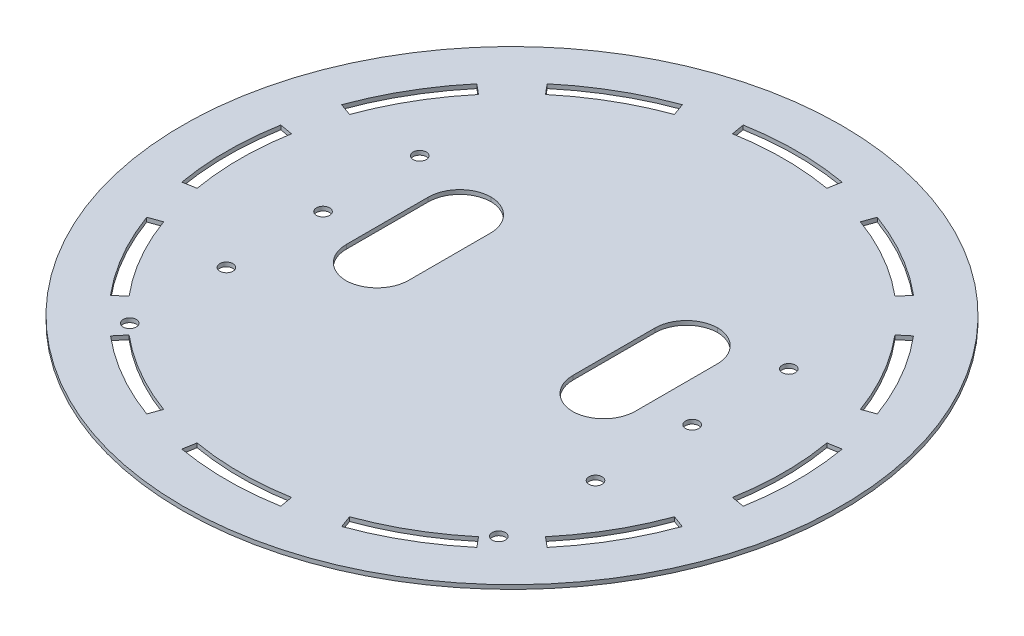
from build123d import *

# Parameters (mm, degrees)
SKETCH1_R            = 1.5875
BOSS_EXTRUDE5_DEPTH  = 1.5875
FILLET2_R            = 2.54
FILLET3_R            = 2.54
FILLET4_R            = 5.08
CUT_EXTRUDE1_START   = -2.54
SKETCH2_R            = 2.38125
SKETCH2_R_2          = 1.5875
CUT_EXTRUDE1_DEPTH   = 2.54
SKETCH3_R            = 1.5875
CUT_EXTRUDE2_DEPTH   = 2.54
CUT_EXTRUDE3_DEPTH   = 2.54
SKETCH5_W            = 15
SKETCH5_H            = 34.925
CUT_EXTRUDE4_DEPTH   = 109.650407999
FILLET5_R            = 7.62
FILLET6_R            = 7.62
BOSS_EXTRUDE6_START  = -1.5875
BOSS_EXTRUDE6_DEPTH  = 1.5875
SKETCH7_R            = 79.375
CUT_EXTRUDE5_DEPTH   = 0.5875
BOSS_EXTRUDE7_START  = -1
SKETCH8_R            = 1.5875
SKETCH8_R_2          = 2.38125
BOSS_EXTRUDE7_DEPTH  = 1
SKETCH9_R            = 1.5875
CUT_EXTRUDE7_DEPTH   = 2.54
BOSS_EXTRUDE8_START  = -1
BOSS_EXTRUDE8_DEPTH  = 1
CUT_EXTRUDE9_START   = -2.54
CUT_EXTRUDE9_DEPTH   = 2.54
BOSS_EXTRUDE9_START  = -1
BOSS_EXTRUDE9_DEPTH  = 1
CUT_EXTRUDE10_START  = -2.54
CUT_EXTRUDE10_DEPTH  = 2.54
BOSS_EXTRUDE10_START = -1
BOSS_EXTRUDE10_DEPTH = 1
CUT_EXTRUDE11_START  = -2.54
CUT_EXTRUDE11_DEPTH  = 2.54
BOSS_EXTRUDE11_START = -1
BOSS_EXTRUDE11_DEPTH = 1


with BuildPart() as part:
    # Sketch1 → Boss-Extrude5 (new body)
    with BuildSketch(Plane(origin=(0, 0, 0), x_dir=(1, 0, 0), z_dir=(0, 1, 0))):
        with BuildLine():
            ThreePointArc((-63.5, -47.625), (-35.497579143, -70.995158286), (0, -79.375))
            ThreePointArc((0, -79.375), (35.497579143, -70.995158286), (63.5, -47.625))
            Line((63.5, -47.625), (50.8, -47.625))
            Line((50.8, -47.625), (50.8, 22.225))
            Line((50.8, 22.225), (76.2, 22.225))
            ThreePointArc((76.2, 22.225), (0, 79.375), (-76.2, 22.225))
            Line((-76.2, 22.225), (-50.8, 22.225))
            Line((-50.8, 22.225), (-50.8, -47.625))
            Line((-50.8, -47.625), (-63.5, -47.625))
        make_face()
        with Locations(Location((-7.14375, -66.675, 0), (0, 0, 270))):
            Circle(SKETCH1_R, mode=Mode.SUBTRACT)
        with BuildLine():
            ThreePointArc((8.73125, -66.675), (7.14375, -68.2625), (5.55625, -66.675))
            ThreePointArc((5.55625, -66.675), (7.14375, -65.0875), (8.73125, -66.675))
        make_face(mode=Mode.SUBTRACT)
        with Locations(Location((-7.14375, 66.675, 0), (0, 0, 270))):
            Circle(SKETCH1_R, mode=Mode.SUBTRACT)
        with Locations(Location((7.14375, 66.675, 0), (0, 0, 270))):
            Circle(SKETCH1_R, mode=Mode.SUBTRACT)
    extrude(amount=BOSS_EXTRUDE5_DEPTH)

    # Fillet2
    fillet2_edges = [part.edges().sort_by_distance(p)[0] for p in [
        (-63.5, 0.79375, 47.625),
    ]]
    fillet(fillet2_edges, radius=FILLET2_R)

    # Fillet3
    fillet3_edges = [part.edges().sort_by_distance(p)[0] for p in [
        (63.5, 0.79375, 47.625),
    ]]
    fillet(fillet3_edges, radius=FILLET3_R)

    # Fillet4
    fillet4_edges = [part.edges().sort_by_distance(p)[0] for p in [
        (-76.2, 0.79375, -22.225),
        (76.2, 0.79375, -22.225),
    ]]
    fillet(fillet4_edges, radius=FILLET4_R)

    # Sketch2 → Cut-Extrude1 (cut)
    # profile 1 of 10: a face of its own
    with BuildSketch(Plane(origin=(0, 1.5875, 0), x_dir=(1, 0, 0), z_dir=(0, 1, 0)).offset(CUT_EXTRUDE1_START)):
        with BuildLine():
            Line((-61.088622125, 27.654457796), (-59.642408406, 26.999765402))
            ThreePointArc((-59.642408406, 26.999765402), (-52.384826382, 39.268743005), (-42.643785254, 49.676068599))
            Line((-42.643785254, 49.676068599), (-43.677815048, 50.880617741))
            Line((-43.677815048, 50.880617741), (-44.711844841, 52.085166883))
            ThreePointArc((-44.711844841, 52.085166883), (-54.925289002, 41.173126022), (-62.534835843, 28.309150189))
            Line((-62.534835843, 28.309150189), (-61.088622125, 27.654457796))
        make_face()
    # profile 2 of 10: a face of its own
    with BuildSketch(Plane(origin=(0, 1.5875, 0), x_dir=(1, 0, 0), z_dir=(0, 1, 0)).offset(CUT_EXTRUDE1_START)):
        with BuildLine():
            Line((-39.077069744, 54.493774041), (-38.151958122, 53.203686937))
            ThreePointArc((-38.151958122, 53.203686937), (-25.732218917, 60.200142208), (-12.092567045, 64.342629994))
            Line((-12.092567045, 64.342629994), (-12.385788543, 65.902815048))
            Line((-12.385788543, 65.902815048), (-12.679010041, 67.463000102))
            ThreePointArc((-12.679010041, 67.463000102), (-26.980132574, 63.119617589), (-40.002181367, 55.783861145))
            Line((-40.002181367, 55.783861145), (-39.077069744, 54.493774041))
        make_face()
    # profile 3 of 10: a face of its own
    with BuildSketch(Plane(origin=(0, 1.5875, 0), x_dir=(1, 0, 0), z_dir=(0, 1, 0)).offset(CUT_EXTRUDE1_START)):
        with Locations(Location((-7.14375, 66.675, 0), (0, 0, 270))):
            Circle(SKETCH2_R)
        with Locations((-7.14375, 66.675)):
            Circle(SKETCH2_R_2, mode=Mode.SUBTRACT)
    # profile 4 of 10: a face of its own
    with BuildSketch(Plane(origin=(0, 1.5875, 0), x_dir=(1, 0, 0), z_dir=(0, 1, 0)).offset(CUT_EXTRUDE1_START)):
        with Locations(Location((7.14375, 66.675, 0), (0, 0, 270))):
            Circle(SKETCH2_R)
        with Locations((7.14375, 66.675)):
            Circle(SKETCH2_R_2, mode=Mode.SUBTRACT)
    # profile 5 of 10: a face of its own
    with BuildSketch(Plane(origin=(0, 1.5875, 0), x_dir=(1, 0, 0), z_dir=(0, 1, 0)).offset(CUT_EXTRUDE1_START)):
        with BuildLine():
            ThreePointArc((12.679010041, 67.463000102), (26.980132574, 63.119617589), (40.002181367, 55.783861145))
            Line((40.002181367, 55.783861145), (39.077069744, 54.493774041))
            Line((39.077069744, 54.493774041), (38.151958122, 53.203686937))
            ThreePointArc((38.151958122, 53.203686937), (25.732218917, 60.200142208), (12.092567045, 64.342629994))
            Line((12.092567045, 64.342629994), (12.385788543, 65.902815048))
            Line((12.385788543, 65.902815048), (12.679010041, 67.463000102))
        make_face()
    # profile 6 of 10: a face of its own
    with BuildSketch(Plane(origin=(0, 1.5875, 0), x_dir=(1, 0, 0), z_dir=(0, 1, 0)).offset(CUT_EXTRUDE1_START)):
        with BuildLine():
            ThreePointArc((44.711844841, 52.085166883), (54.925289002, 41.173126022), (62.534835843, 28.309150189))
            Line((62.534835843, 28.309150189), (59.642408406, 26.999765402))
            ThreePointArc((59.642408406, 26.999765402), (52.384826382, 39.268743005), (42.643785254, 49.676068599))
            Line((42.643785254, 49.676068599), (43.677815048, 50.880617741))
            Line((43.677815048, 50.880617741), (44.711844841, 52.085166883))
        make_face()
    # profile 7 of 10: a face of its own
    with BuildSketch(Plane(origin=(0, 1.5875, 0), x_dir=(1, 0, 0), z_dir=(0, 1, 0)).offset(CUT_EXTRUDE1_START)):
        with BuildLine():
            ThreePointArc((-12.679010041, -67.463000102), (-26.980132574, -63.119617589), (-40.002181367, -55.783861145))
            Line((-40.002181367, -55.783861145), (-39.077069744, -54.493774041))
            Line((-39.077069744, -54.493774041), (-38.151958122, -53.203686937))
            ThreePointArc((-38.151958122, -53.203686937), (-25.732218917, -60.200142208), (-12.092567045, -64.342629994))
            Line((-12.092567045, -64.342629994), (-12.385788543, -65.902815048))
            Line((-12.385788543, -65.902815048), (-12.679010041, -67.463000102))
        make_face()
    # profile 8 of 10: a face of its own
    with BuildSketch(Plane(origin=(0, 1.5875, 0), x_dir=(1, 0, 0), z_dir=(0, 1, 0)).offset(CUT_EXTRUDE1_START)):
        with Locations(Location((-7.14375, -66.675, 0), (0, 0, 270))):
            Circle(SKETCH2_R)
        with Locations((-7.14375, -66.675)):
            Circle(SKETCH2_R_2, mode=Mode.SUBTRACT)
    # profile 9 of 10: a face of its own
    with BuildSketch(Plane(origin=(0, 1.5875, 0), x_dir=(1, 0, 0), z_dir=(0, 1, 0)).offset(CUT_EXTRUDE1_START)):
        with Locations(Location((7.14375, -66.675, 0), (0, 0, 270))):
            Circle(SKETCH2_R)
        with Locations((7.14375, -66.675)):
            Circle(SKETCH2_R_2, mode=Mode.SUBTRACT)
    # profile 10 of 10: a face of its own
    with BuildSketch(Plane(origin=(0, 1.5875, 0), x_dir=(1, 0, 0), z_dir=(0, 1, 0)).offset(CUT_EXTRUDE1_START)):
        with BuildLine():
            ThreePointArc((12.092567045, -64.342629994), (25.732218917, -60.200142208), (38.151958122, -53.203686937))
            Line((38.151958122, -53.203686937), (39.077069744, -54.493774041))
            Line((39.077069744, -54.493774041), (40.002181367, -55.783861145))
            ThreePointArc((40.002181367, -55.783861145), (26.980132574, -63.119617589), (12.679010041, -67.463000102))
            Line((12.679010041, -67.463000102), (12.385788543, -65.902815048))
            Line((12.385788543, -65.902815048), (12.092567045, -64.342629994))
        make_face()
    extrude(amount=CUT_EXTRUDE1_DEPTH, mode=Mode.SUBTRACT)

    # Sketch3 → Cut-Extrude2 (cut)
    with BuildSketch(Plane(origin=(0, 1.5875, 0), x_dir=(1, 0, 0), z_dir=(0, 1, 0))):
        with Locations(Location((-44.45, -47.625, 0), (0, 0, 270))):
            Circle(SKETCH3_R)
        with Locations(Location((-44.45, 22.225, 0), (0, 0, 270))):
            Circle(SKETCH3_R)
        with Locations(Location((44.45, 22.225, 0), (0, 0, 270))):
            Circle(SKETCH3_R)
        with Locations(Location((44.45, -47.625, 0), (0, 0, 270))):
            Circle(SKETCH3_R)
    extrude(amount=-CUT_EXTRUDE2_DEPTH, mode=Mode.SUBTRACT)

    # Sketch4 → Cut-Extrude3 (cut)
    with BuildSketch(Plane(origin=(0, 1.5875, 0), x_dir=(1, 0, 0), z_dir=(0, 1, 0))):
        with BuildLine():
            ThreePointArc((-44.45, -11.1125), (-46.0375, -12.7), (-44.45, -14.2875))
            Line((-44.45, -14.2875), (-44.45, -11.1125))
        make_face()
        with BuildLine():
            Line((-44.45, -11.1125), (-44.45, -14.2875))
            ThreePointArc((-44.45, -14.2875), (-43.327467985, -13.822532015), (-42.8625, -12.7))
            ThreePointArc((-42.8625, -12.7), (-43.327467985, -11.577467985), (-44.45, -11.1125))
        make_face()
        with BuildLine():
            ThreePointArc((44.45, -11.1125), (42.8625, -12.7), (44.45, -14.2875))
            Line((44.45, -14.2875), (44.45, -11.1125))
        make_face()
        with BuildLine():
            Line((44.45, -11.1125), (44.45, -14.2875))
            ThreePointArc((44.45, -14.2875), (45.572532015, -13.822532015), (46.0375, -12.7))
            ThreePointArc((46.0375, -12.7), (45.572532015, -11.577467985), (44.45, -11.1125))
        make_face()
    extrude(amount=-CUT_EXTRUDE3_DEPTH, mode=Mode.SUBTRACT)

    # Sketch5 → Cut-Extrude4 (cut, through all)
    with BuildSketch(Plane(origin=(0, 1.5875, 0), x_dir=(1, 0, 0), z_dir=(0, 1, 0))):
        with Locations((-27.3, 4.7625)):
            Rectangle(SKETCH5_W, SKETCH5_H)
        with Locations((27.3, 4.7625)):
            Rectangle(SKETCH5_W, SKETCH5_H)
    extrude(amount=-CUT_EXTRUDE4_DEPTH, mode=Mode.SUBTRACT)

    # Fillet5
    # the kernel refuses this fillet: 7.62 mm, written as the material it adds along each edge
    with BuildSketch(Plane(origin=(-19.8, 1.5875, 12.7), x_dir=(0, 0, -1), z_dir=(0, -1, 0))) as fillet5_piece_1:
        with BuildLine():
            CenterArc((FILLET5_R, -FILLET5_R), FILLET5_R, 90, 90)
            Line((0, -FILLET5_R), (0, 0))
            Line((0, 0), (FILLET5_R, 0))
        make_face()
    extrude(amount=1.5875)
    with BuildSketch(Plane(origin=(-34.8, 1.5875, 12.7), x_dir=(0, 0, -1), z_dir=(0, -1, 0)), Plane(origin=(-19.8, 1.5875, -22.225), x_dir=(0, 0, 1), z_dir=(0, -1, 0)), Plane(origin=(-34.8, 1.5875, -22.225), x_dir=(1, 0, 0), z_dir=(0, -1, 0))) as fillet5_piece_2:
        with BuildLine():
            CenterArc((FILLET5_R, FILLET5_R), FILLET5_R, 180, 90)
            Line((0, FILLET5_R), (0, 0))
            Line((0, 0), (FILLET5_R, 0))
        make_face()
    extrude(amount=1.5875)

    # Fillet6
    # the kernel refuses this fillet: 7.62 mm, written as the material it adds along each edge
    with BuildSketch(Plane(origin=(34.8, 1.5875, 12.7), x_dir=(0, 0, -1), z_dir=(0, -1, 0)), Plane(origin=(34.8, 1.5875, -22.225), x_dir=(-1, 0, 0), z_dir=(0, -1, 0))) as fillet6_piece_1:
        with BuildLine():
            CenterArc((FILLET6_R, -FILLET6_R), FILLET6_R, 90, 90)
            Line((0, -FILLET6_R), (0, 0))
            Line((0, 0), (FILLET6_R, 0))
        make_face()
    extrude(amount=1.5875)
    with BuildSketch(Plane(origin=(19.8, 1.5875, -22.225), x_dir=(1, 0, 0), z_dir=(0, -1, 0)), Plane(origin=(19.8, 1.5875, 12.7), x_dir=(0, 0, -1), z_dir=(0, -1, 0))) as fillet6_piece_2:
        with BuildLine():
            CenterArc((FILLET6_R, FILLET6_R), FILLET6_R, 180, 90)
            Line((0, FILLET6_R), (0, 0))
            Line((0, 0), (FILLET6_R, 0))
        make_face()
    extrude(amount=1.5875)

    # Sketch6 → Boss-Extrude6 (add)
    with BuildSketch(Plane(origin=(0, 1.5875, 0), x_dir=(1, 0, 0), z_dir=(0, 1, 0)).offset(BOSS_EXTRUDE6_START)):
        with BuildLine():
            Line((-50.8, -60.989758362), (-50.8, 22.225))
            Line((-50.8, 22.225), (-69.095470184, 22.225))
            Line((-69.095470184, 22.225), (-69.095470184, 39.066694575))
            ThreePointArc((-69.095470184, 39.066694575), (-78.080435361, -14.277122916), (-50.8, -60.989758362))
        make_face()
        with BuildLine():
            Line((50.8, 22.225), (50.8, -60.989758362))
            ThreePointArc((50.8, -60.989758362), (71.877119534, -33.675960454), (79.375, 0))
            ThreePointArc((79.375, 0), (76.762111653, 20.198238526), (69.095470184, 39.066694575))
            Line((69.095470184, 39.066694575), (69.095470184, 22.225))
            Line((69.095470184, 22.225), (50.8, 22.225))
        make_face()
    extrude(amount=BOSS_EXTRUDE6_DEPTH)

    # Sketch7 → Cut-Extrude5 (cut)
    with BuildSketch(Plane.XZ):
        with Locations(Location((0, 0, 0), (0, 0, 270))):
            Circle(SKETCH7_R)
    extrude(amount=-CUT_EXTRUDE5_DEPTH, mode=Mode.SUBTRACT)

    # Sketch8 → Boss-Extrude7 (add)
    with BuildSketch(Plane(origin=(0, 1.5875, 0), x_dir=(1, 0, 0), z_dir=(0, 1, 0)).offset(BOSS_EXTRUDE7_START)):
        with Locations((-44.45, -12.7)):
            Circle(SKETCH8_R)
        with Locations((44.45, -12.7)):
            Circle(SKETCH8_R)
        with Locations((-7.14375, -66.675)):
            Circle(SKETCH8_R_2)
        with Locations((7.14375, -66.675)):
            Circle(SKETCH8_R_2)
        with Locations((-7.14375, 66.675)):
            Circle(SKETCH8_R_2)
        with Locations((7.14375, 66.675)):
            Circle(SKETCH8_R_2)
    extrude(amount=BOSS_EXTRUDE7_DEPTH)

    # Sketch9 → Cut-Extrude7 (cut)
    with BuildSketch(Plane(origin=(0, 1.5875, 0), x_dir=(1, 0, 0), z_dir=(0, 1, 0))):
        with Locations(Location((-44.45, -1.058333333, 0), (0, 0, 270))):
            Circle(SKETCH9_R)
        with Locations(Location((-44.45, -24.341666667, 0), (0, 0, 270))):
            Circle(SKETCH9_R)
        with Locations(Location((44.45, -24.341666667, 0), (0, 0, 270))):
            Circle(SKETCH9_R)
        with Locations(Location((44.45, -1.058333333, 0), (0, 0, 270))):
            Circle(SKETCH9_R)
    extrude(amount=-CUT_EXTRUDE7_DEPTH, mode=Mode.SUBTRACT)

    # Sketch10 → Boss-Extrude8 (add)
    with BuildSketch(Plane(origin=(0, 1.5875, 0), x_dir=(1, 0, 0), z_dir=(0, 1, 0)).offset(BOSS_EXTRUDE8_START)):
        with BuildLine():
            Line((-44.711844841, 52.085166883), (-42.643785254, 49.676068599))
            ThreePointArc((-42.643785254, 49.676068599), (-52.384826382, 39.268743005), (-59.642408406, 26.999765402))
            Line((-59.642408406, 26.999765402), (-62.534835843, 28.309150189))
            ThreePointArc((-62.534835843, 28.309150189), (-54.925289002, 41.173126022), (-44.711844841, 52.085166883))
        make_face()
        with BuildLine():
            Line((-12.679010041, 67.463000102), (-12.092567045, 64.342629994))
            ThreePointArc((-12.092567045, 64.342629994), (-25.732218917, 60.200142208), (-38.151958122, 53.203686937))
            Line((-38.151958122, 53.203686937), (-40.002181367, 55.783861145))
            ThreePointArc((-40.002181367, 55.783861145), (-26.980132574, 63.119617589), (-12.679010041, 67.463000102))
        make_face()
        with BuildLine():
            Line((12.092567045, 64.342629994), (12.679010041, 67.463000102))
            ThreePointArc((12.679010041, 67.463000102), (26.980132574, 63.119617589), (40.002181367, 55.783861145))
            Line((40.002181367, 55.783861145), (38.151958122, 53.203686937))
            ThreePointArc((38.151958122, 53.203686937), (25.732218917, 60.200142208), (12.092567045, 64.342629994))
        make_face()
        with BuildLine():
            Line((42.643785254, 49.676068599), (44.711844841, 52.085166883))
            ThreePointArc((44.711844841, 52.085166883), (54.925289002, 41.173126022), (62.534835843, 28.309150189))
            Line((62.534835843, 28.309150189), (59.642408406, 26.999765402))
            ThreePointArc((59.642408406, 26.999765402), (52.384826382, 39.268743005), (42.643785254, 49.676068599))
        make_face()
    extrude(amount=BOSS_EXTRUDE8_DEPTH)

    # Sketch11 → Cut-Extrude9 (cut)
    with BuildSketch(Plane(origin=(0, 1.5875, 0), x_dir=(1, 0, 0), z_dir=(0, 1, 0)).offset(CUT_EXTRUDE9_START)):
        with BuildLine():
            Line((11.919924408, -67.601250584), (11.368591443, -64.474485968))
            ThreePointArc((11.368591443, -64.474485968), (0, -65.46910884), (-11.368591443, -64.474485968))
            Line((-11.368591443, -64.474485968), (-11.919924408, -67.601250584))
            ThreePointArc((-11.919924408, -67.601250584), (0, -68.64410884), (11.919924408, -67.601250584))
        make_face()
        with BuildLine():
            Line((-11.919924408, 67.601250584), (-11.368591443, 64.474485968))
            ThreePointArc((-11.368591443, 64.474485968), (0, 65.46910884), (11.368591443, 64.474485968))
            Line((11.368591443, 64.474485968), (11.919924408, 67.601250584))
            ThreePointArc((11.919924408, 67.601250584), (0, 68.64410884), (-11.919924408, 67.601250584))
        make_face()
        with BuildLine():
            Line((-48.538714849, 48.538714849), (-46.293650819, 46.293650819))
            ThreePointArc((-46.293650819, 46.293650819), (-42.082731979, 50.152247023), (-37.551538139, 53.629154344))
            Line((-37.551538139, 53.629154344), (-39.372643325, 56.229962084))
            ThreePointArc((-39.372643325, 56.229962084), (-44.12358264, 52.584438129), (-48.538714849, 48.538714849))
        make_face()
        with BuildLine():
            ThreePointArc((-53.629154344, 37.551538139), (-50.152247023, 42.082731979), (-46.293650819, 46.293650819))
            Line((-46.293650819, 46.293650819), (-48.538714849, 48.538714849))
            ThreePointArc((-48.538714849, 48.538714849), (-52.584438129, 44.12358264), (-56.229962084, 39.372643325))
            Line((-56.229962084, 39.372643325), (-53.629154344, 37.551538139))
        make_face()
        with BuildLine():
            Line((-68.64410884, 0), (-65.46910884, 0))
            ThreePointArc((-65.46910884, 0), (-65.219979115, 5.706008808), (-64.474485968, 11.368591443))
            Line((-64.474485968, 11.368591443), (-67.601250584, 11.919924408))
            ThreePointArc((-67.601250584, 11.919924408), (-68.382897281, 5.982728291), (-68.64410884, 0))
        make_face()
        with BuildLine():
            ThreePointArc((-64.474485968, -11.368591443), (-65.219979115, -5.706008808), (-65.46910884, 0))
            Line((-65.46910884, 0), (-68.64410884, 0))
            ThreePointArc((-68.64410884, 0), (-68.382897281, -5.982728291), (-67.601250584, -11.919924408))
            Line((-67.601250584, -11.919924408), (-64.474485968, -11.368591443))
        make_face()
        with BuildLine():
            Line((67.601250584, 11.919924408), (64.474485968, 11.368591443))
            ThreePointArc((64.474485968, 11.368591443), (65.219979115, 5.706008808), (65.46910884, 0))
            ThreePointArc((65.46910884, 0), (65.219979115, -5.706008808), (64.474485968, -11.368591443))
            Line((64.474485968, -11.368591443), (67.601250584, -11.919924408))
            ThreePointArc((67.601250584, -11.919924408), (68.382897281, -5.982728291), (68.64410884, 0))
            ThreePointArc((68.64410884, 0), (68.382897281, 5.982728291), (67.601250584, 11.919924408))
        make_face()
        with BuildLine():
            Line((48.538714849, 48.538714849), (46.293650819, 46.293650819))
            ThreePointArc((46.293650819, 46.293650819), (50.152247023, 42.082731979), (53.629154344, 37.551538139))
            Line((53.629154344, 37.551538139), (56.229962084, 39.372643325))
            ThreePointArc((56.229962084, 39.372643325), (52.584438129, 44.12358264), (48.538714849, 48.538714849))
        make_face()
        with BuildLine():
            ThreePointArc((37.551538139, 53.629154344), (42.082731979, 50.152247023), (46.293650819, 46.293650819))
            Line((46.293650819, 46.293650819), (48.538714849, 48.538714849))
            ThreePointArc((48.538714849, 48.538714849), (44.12358264, 52.584438129), (39.372643325, 56.229962084))
            Line((39.372643325, 56.229962084), (37.551538139, 53.629154344))
        make_face()
    extrude(amount=CUT_EXTRUDE9_DEPTH, mode=Mode.SUBTRACT)

    # Sketch12 → Boss-Extrude9 (add)
    with BuildSketch(Plane(origin=(0, 1.5875, 0), x_dir=(1, 0, 0), z_dir=(0, 1, 0)).offset(BOSS_EXTRUDE9_START)):
        with BuildLine():
            ThreePointArc((-12.092567045, -64.342629994), (-14.887643702, -63.753919701), (-17.654380884, -63.043850199))
            Line((-17.654380884, -63.043850199), (-18.510550462, -66.101234482))
            ThreePointArc((-18.510550462, -66.101234482), (-15.609637167, -66.845739624), (-12.679010041, -67.463000102))
            Line((-12.679010041, -67.463000102), (-12.092567045, -64.342629994))
        make_face()
        with BuildLine():
            Line((18.510550462, -66.101234482), (17.654380884, -63.043850199))
            ThreePointArc((17.654380884, -63.043850199), (14.887643702, -63.753919701), (12.092567045, -64.342629994))
            Line((12.092567045, -64.342629994), (12.679010041, -67.463000102))
            ThreePointArc((12.679010041, -67.463000102), (15.609637167, -66.845739624), (18.510550462, -66.101234482))
        make_face()
    extrude(amount=BOSS_EXTRUDE9_DEPTH)

    # Sketch13 → Cut-Extrude10 (cut)
    with BuildSketch(Plane(origin=(0, 1.5875, 0), x_dir=(1, 0, 0), z_dir=(0, 1, 0)).offset(CUT_EXTRUDE10_START)):
        with BuildLine():
            Line((-52.584438129, -44.12358264), (-50.152247023, -42.082731979))
            ThreePointArc((-50.152247023, -42.082731979), (-56.697911418, -32.73455442), (-61.520838466, -22.391753989))
            Line((-61.520838466, -22.391753989), (-64.504362537, -23.477667944))
            ThreePointArc((-64.504362537, -23.477667944), (-59.447542075, -34.32205442), (-52.584438129, -44.12358264))
        make_face()
        with BuildLine():
            Line((64.504362537, -23.477667944), (61.520838466, -22.391753989))
            ThreePointArc((61.520838466, -22.391753989), (56.697911418, -32.73455442), (50.152247023, -42.082731979))
            Line((50.152247023, -42.082731979), (52.584438129, -44.12358264))
            ThreePointArc((52.584438129, -44.12358264), (59.447542075, -34.32205442), (64.504362537, -23.477667944))
        make_face()
        with BuildLine():
            Line((52.584438129, 44.12358264), (50.152247023, 42.082731979))
            ThreePointArc((50.152247023, 42.082731979), (56.697911418, 32.73455442), (61.520838466, 22.391753989))
            Line((61.520838466, 22.391753989), (64.504362537, 23.477667944))
            ThreePointArc((64.504362537, 23.477667944), (59.447542075, 34.32205442), (52.584438129, 44.12358264))
        make_face()
        with BuildLine():
            Line((23.477667944, 64.504362537), (22.391753989, 61.520838466))
            ThreePointArc((22.391753989, 61.520838466), (32.73455442, 56.697911418), (42.082731979, 50.152247023))
            Line((42.082731979, 50.152247023), (44.12358264, 52.584438129))
            ThreePointArc((44.12358264, 52.584438129), (34.32205442, 59.447542075), (23.477667944, 64.504362537))
        make_face()
        with BuildLine():
            Line((-44.12358264, 52.584438129), (-42.082731979, 50.152247023))
            ThreePointArc((-42.082731979, 50.152247023), (-32.73455442, 56.697911418), (-22.391753989, 61.520838466))
            Line((-22.391753989, 61.520838466), (-23.477667944, 64.504362537))
            ThreePointArc((-23.477667944, 64.504362537), (-34.32205442, 59.447542075), (-44.12358264, 52.584438129))
        make_face()
        with BuildLine():
            Line((-64.504362537, 23.477667944), (-61.520838466, 22.391753989))
            ThreePointArc((-61.520838466, 22.391753989), (-56.697911418, 32.73455442), (-50.152247023, 42.082731979))
            Line((-50.152247023, 42.082731979), (-52.584438129, 44.12358264))
            ThreePointArc((-52.584438129, 44.12358264), (-59.447542075, 34.32205442), (-64.504362537, 23.477667944))
        make_face()
    extrude(amount=CUT_EXTRUDE10_DEPTH, mode=Mode.SUBTRACT)

    # Sketch15 → Boss-Extrude10 (add)
    with BuildSketch(Plane(origin=(0, 1.5875, 0), x_dir=(1, 0, 0), z_dir=(0, 1, 0)).offset(BOSS_EXTRUDE10_START)):
        with BuildLine():
            Line((-52.584438129, 44.12358264), (-50.152247023, 42.082731979))
            ThreePointArc((-50.152247023, 42.082731979), (-46.293650819, 46.293650819), (-42.082731979, 50.152247023))
            Line((-42.082731979, 50.152247023), (-44.12358264, 52.584438129))
            ThreePointArc((-44.12358264, 52.584438129), (-48.538714849, 48.538714849), (-52.584438129, 44.12358264))
        make_face()
        with BuildLine():
            Line((44.12358264, 52.584438129), (42.082731979, 50.152247023))
            ThreePointArc((42.082731979, 50.152247023), (46.293650819, 46.293650819), (50.152247023, 42.082731979))
            Line((50.152247023, 42.082731979), (52.584438129, 44.12358264))
            ThreePointArc((52.584438129, 44.12358264), (48.538714849, 48.538714849), (44.12358264, 52.584438129))
        make_face()
    extrude(amount=BOSS_EXTRUDE10_DEPTH)

    # Sketch16 → Cut-Extrude11 (cut)
    with BuildSketch(Plane(origin=(0, 1.5875, 0), x_dir=(1, 0, 0), z_dir=(0, 1, 0)).offset(CUT_EXTRUDE11_START)):
        with BuildLine():
            Line((-23.477667944, -64.504362537), (-22.391753989, -61.520838466))
            ThreePointArc((-22.391753989, -61.520838466), (-32.73455442, -56.697911418), (-42.082731979, -50.152247022))
            Line((-42.082731979, -50.152247022), (-44.12358264, -52.584438129))
            ThreePointArc((-44.12358264, -52.584438129), (-34.32205442, -59.447542075), (-23.477667944, -64.504362537))
        make_face()
        with BuildLine():
            ThreePointArc((42.082731979, -50.152247022), (32.73455442, -56.697911418), (22.391753989, -61.520838466))
            Line((22.391753989, -61.520838466), (23.477667944, -64.504362537))
            ThreePointArc((23.477667944, -64.504362537), (34.32205442, -59.447542075), (44.12358264, -52.584438129))
            Line((44.12358264, -52.584438129), (42.082731979, -50.152247022))
        make_face()
    extrude(amount=CUT_EXTRUDE11_DEPTH, mode=Mode.SUBTRACT)

    # Sketch17 → Boss-Extrude11 (add)
    with BuildSketch(Plane(origin=(0, 1.5875, 0), x_dir=(1, 0, 0), z_dir=(0, 1, 0)).offset(BOSS_EXTRUDE11_START)):
        with BuildLine():
            Line((-11.919924408, -67.601250584), (-11.368591443, -64.474485968))
            ThreePointArc((-11.368591443, -64.474485968), (-16.944652234, -63.238303052), (-22.391753989, -61.520838466))
            Line((-22.391753989, -61.520838466), (-23.477667944, -64.504362537))
            ThreePointArc((-23.477667944, -64.504362537), (-17.766402702, -66.305117551), (-11.919924408, -67.601250584))
        make_face()
        with BuildLine():
            ThreePointArc((22.391753989, -61.520838466), (16.944652234, -63.238303052), (11.368591443, -64.474485968))
            Line((11.368591443, -64.474485968), (11.919924408, -67.601250584))
            ThreePointArc((11.919924408, -67.601250584), (17.766402702, -66.305117551), (23.477667944, -64.504362537))
            Line((23.477667944, -64.504362537), (22.391753989, -61.520838466))
        make_face()
    extrude(amount=BOSS_EXTRUDE11_DEPTH)


solid = part.part
